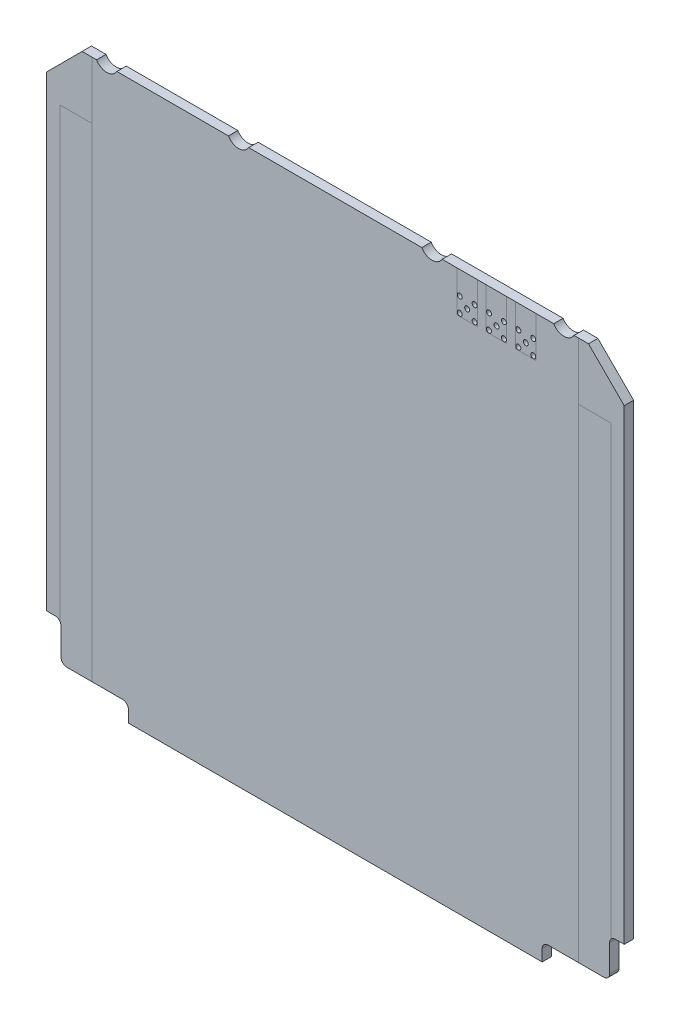
from build123d import *

# Parameters (mm, degrees)
SKETCH1_W                         = 98.6
SKETCH1_H                         = 95.3
BASICSIZE_DEPTH                   = 1.6
CHAMFER1_SIZE                     = 6.1
BACKPLANESIDESCREWCUTOUT_DEPTH    = 71.235674696
LPATTERN3_COUNT                   = 2
LPATTERN3_PITCH                   = 22.5
MIRROR3_COPY_1_DEPTH              = 71.235674696
MIRROR3_COPY_2_DEPTH              = 71.235674696
CUT_EXTRUDE4_DEPTH                = 71.235674696
FILLET1_R                         = 1
FILLET1_OF_MIRROR1_R              = 1
SKETCH5_R                         = 0.425
CUT_EXTRUDE3_DEPTH                = 71.235674696
LPATTERN2_COUNT                   = 3
LPATTERN2_PITCH                   = 5
PARTFOOTPRINTS_W                  = 3.5
PARTFOOTPRINTS_H                  = 6.95
FOOTPRINTS_DEPTH                  = 0.0001
KEEPOUT_BOTTOM_DEPTH              = 0.0001
CAUTION_TOP_START                 = -0.00015
CAUTION_TOP_DEPTH                 = 0.00015
CLEARANCES_SIDE_SIDE_COPY_1_DEPTH = 0.0001
CLEARANCES_SIDE_SIDE_START        = -0.00015
CLEARANCES_SIDE_SIDE_COPY_2_DEPTH = 0.00015
CLEARANCES_SIDE_SIDE_COPY_3_DEPTH = 0.0001
CLEARANCES_SIDE_SIDE_COPY_4_DEPTH = 0.00015


with BuildPart() as part:
    # Sketch1 → basicSize (new body)
    with BuildSketch(Plane(origin=(0, 0, -0.0125), x_dir=(-1, 0, 0), z_dir=(0, 0, -1))):
        with Locations((0, -2.35)):
            Rectangle(SKETCH1_W, SKETCH1_H)
    extrude(amount=-BASICSIZE_DEPTH)

    # Chamfer1
    chamfer1_edges = [part.edges().sort_by_distance(p)[0] for p in [
        (49.3, 45.3, 0.7875),
        (-49.3, 45.3, 0.7875),
    ]]
    chamfer(chamfer1_edges, length=CHAMFER1_SIZE)

    # Sketch4 → backplaneSideScrewCutout (cut, symmetric)
    with BuildSketch(Plane.XY.offset(1.5875)):
        with BuildLine():
            Line((37.267949192, 45.3), (40.732050808, 45.3))
            ThreePointArc((40.732050808, 45.3), (39, 44.3), (37.267949192, 45.3))
        make_face()
    backplanesidescrewcutout = extrude(amount=BACKPLANESIDESCREWCUTOUT_DEPTH, both=True, mode=Mode.SUBTRACT)

    # LPattern3: backplaneSideScrewCutout ×2
    with Locations(*[(-i * LPATTERN3_PITCH, 0, 0) for i in range(1, LPATTERN3_COUNT)]):
        add(backplanesidescrewcutout, mode=Mode.SUBTRACT)

    # Mirror3 copy 1 sketch → Mirror3 copy 1 (cut, symmetric)
    with BuildSketch(Plane(origin=(22.5, 0, 1.5875), x_dir=(-1, 0, 0), z_dir=(0, 0, 1))):
        with BuildLine():
            Line((37.267949192, -45.3), (40.732050808, -45.3))
            ThreePointArc((40.732050808, -45.3), (39, -44.3), (37.267949192, -45.3))
        make_face()
    extrude(amount=MIRROR3_COPY_1_DEPTH, both=True, mode=Mode.SUBTRACT)

    # Mirror3 copy 2 sketch → Mirror3 copy 2 (cut, symmetric)
    with BuildSketch(Plane(origin=(0, 0, 1.5875), x_dir=(-1, 0, 0), z_dir=(0, 0, 1))):
        with BuildLine():
            Line((37.267949192, -45.3), (40.732050808, -45.3))
            ThreePointArc((40.732050808, -45.3), (39, -44.3), (37.267949192, -45.3))
        make_face()
    extrude(amount=MIRROR3_COPY_2_DEPTH, both=True, mode=Mode.SUBTRACT)

    # Sketch6 → Cut-Extrude4 (cut, through all)
    with BuildSketch(Plane.XY.offset(1.5875)):
        Polygon((-49.3, -40.4), (-46.8, -40.4), (-46.8, -47), (-35.3, -47), (-35.3, -50), (-49.3, -50), align=None)
    cut_extrude4 = extrude(amount=-CUT_EXTRUDE4_DEPTH, mode=Mode.SUBTRACT)

    # Fillet1
    fillet1_edges = [part.edges().sort_by_distance(p)[0] for p in [
        (-35.3, -47, 0.7875),
        (-46.8, -47, 0.7875),
        (-46.8, -40.4, 0.7875),
    ]]
    fillet(fillet1_edges, radius=FILLET1_R)

    # Mirror1: Cut-Extrude4 across plane
    add(cut_extrude4.mirror(Plane(origin=(0, 0, 0), x_dir=(0, 0, 1), z_dir=(1, 0, 0))), mode=Mode.SUBTRACT)

    # Fillet1 of Mirror1
    fillet1_of_mirror1_edges = [part.edges().sort_by_distance(p)[0] for p in [
        (35.3, -47, 0.7875),
        (46.8, -47, 0.7875),
        (46.8, -40.4, 0.7875),
    ]]
    fillet(fillet1_of_mirror1_edges, radius=FILLET1_OF_MIRROR1_R)

    # Sketch5 → Cut-Extrude3 (cut, through all)
    with BuildSketch(Plane.XY.offset(1.5875)):
        with Locations((22.5, 40.1)):
            Circle(SKETCH5_R)
        with Locations((21.23, 41.37)):
            Circle(SKETCH5_R)
        with Locations((21.23, 38.83)):
            Circle(SKETCH5_R)
        with Locations((23.77, 41.37)):
            Circle(SKETCH5_R)
        with Locations((23.77, 38.83)):
            Circle(SKETCH5_R)
    cut_extrude3 = extrude(amount=-CUT_EXTRUDE3_DEPTH, mode=Mode.SUBTRACT)

    # LPattern2: Cut-Extrude3 ×3
    with Locations(*[(i * LPATTERN2_PITCH, 0, 0) for i in range(1, LPATTERN2_COUNT)]):
        add(cut_extrude3, mode=Mode.SUBTRACT)

    # partFootprints → footPrints (cut)
    with BuildSketch(Plane.XY.offset(1.5875)):
        with Locations((22.5, 41.825)):
            Rectangle(PARTFOOTPRINTS_W, PARTFOOTPRINTS_H)
        with Locations((27.5, 41.825)):
            Rectangle(PARTFOOTPRINTS_W, PARTFOOTPRINTS_H)
        with Locations((32.5, 41.825)):
            Rectangle(PARTFOOTPRINTS_W, PARTFOOTPRINTS_H)
    extrude(amount=-FOOTPRINTS_DEPTH, mode=Mode.SUBTRACT)

    # thermalContacts_upper → keepOut_bottom (cut)
    with BuildSketch(Plane.XY.offset(1.5875)):
        Polygon((-47, 35.5), (-47, -41.5), (-56.192158269, -41.5), (-56.192158269, 47), (-41.5, 47), (-41.5, 35.5), align=None)
    keepout_bottom = extrude(amount=-KEEPOUT_BOTTOM_DEPTH, mode=Mode.SUBTRACT)

    # Sketch3 → caution_top (cut)
    with BuildSketch(Plane.XY.offset(1.5875).offset(CAUTION_TOP_START)):
        with BuildLine():
            Line((-41.5, 35.5), (-47, 35.5))
            Line((-47, 35.5), (-47, -40.8))
            ThreePointArc((-47, -40.8), (-46.851316702, -41.083772234), (-46.8, -41.4))
            Line((-46.8, -41.4), (-46.8, -46))
            ThreePointArc((-46.8, -46), (-46.507106781, -46.707106781), (-45.8, -47))
            Line((-45.8, -47), (-41.5, -47))
            Line((-41.5, -47), (-41.5, 35.5))
        make_face()
    caution_top = extrude(amount=CAUTION_TOP_DEPTH, mode=Mode.SUBTRACT)

    # clearances_top-bottom: keepOut_bottom, caution_top across plane
    add(keepout_bottom.mirror(Plane.XY.offset(0.7875)), mode=Mode.SUBTRACT)
    add(caution_top.mirror(Plane.XY.offset(0.7875)), mode=Mode.SUBTRACT)

    # clearances_side-side copy 1 sketch → clearances_side-side copy 1 (cut)
    with BuildSketch(Plane(origin=(0, 0, -0.0125), x_dir=(-1, 0, 0), z_dir=(0, 0, -1))):
        Polygon((-47, 35.5), (-47, -41.5), (-56.192158269, -41.5), (-56.192158269, 47), (-41.5, 47), (-41.5, 35.5), align=None)
    extrude(amount=-CLEARANCES_SIDE_SIDE_COPY_1_DEPTH, mode=Mode.SUBTRACT)

    # clearances_side-side copy 2 sketch → clearances_side-side copy 2 (cut)
    with BuildSketch(Plane(origin=(0, 0, -0.0125), x_dir=(-1, 0, 0), z_dir=(0, 0, -1)).offset(CLEARANCES_SIDE_SIDE_START)):
        with BuildLine():
            Line((-41.5, 35.5), (-47, 35.5))
            Line((-47, 35.5), (-47, -40.8))
            ThreePointArc((-47, -40.8), (-46.851316702, -41.083772234), (-46.8, -41.4))
            Line((-46.8, -41.4), (-46.8, -46))
            ThreePointArc((-46.8, -46), (-46.507106781, -46.707106781), (-45.8, -47))
            Line((-45.8, -47), (-41.5, -47))
            Line((-41.5, -47), (-41.5, 35.5))
        make_face()
    extrude(amount=CLEARANCES_SIDE_SIDE_COPY_2_DEPTH, mode=Mode.SUBTRACT)

    # clearances_side-side copy 3 sketch → clearances_side-side copy 3 (cut)
    with BuildSketch(Plane(origin=(0, 0, 1.5875), x_dir=(-1, 0, 0), z_dir=(0, 0, 1))):
        Polygon((-47, -35.5), (-47, 41.5), (-56.192158269, 41.5), (-56.192158269, -47), (-41.5, -47), (-41.5, -35.5), align=None)
    extrude(amount=-CLEARANCES_SIDE_SIDE_COPY_3_DEPTH, mode=Mode.SUBTRACT)

    # clearances_side-side copy 4 sketch → clearances_side-side copy 4 (cut)
    with BuildSketch(Plane(origin=(0, 0, 1.5875), x_dir=(-1, 0, 0), z_dir=(0, 0, 1)).offset(CLEARANCES_SIDE_SIDE_START)):
        with BuildLine():
            Line((-41.5, -35.5), (-47, -35.5))
            Line((-47, -35.5), (-47, 40.8))
            ThreePointArc((-47, 40.8), (-46.851316702, 41.083772234), (-46.8, 41.4))
            Line((-46.8, 41.4), (-46.8, 46))
            ThreePointArc((-46.8, 46), (-46.507106781, 46.707106781), (-45.8, 47))
            Line((-45.8, 47), (-41.5, 47))
            Line((-41.5, 47), (-41.5, -35.5))
        make_face()
    extrude(amount=CLEARANCES_SIDE_SIDE_COPY_4_DEPTH, mode=Mode.SUBTRACT)


solid = part.part
